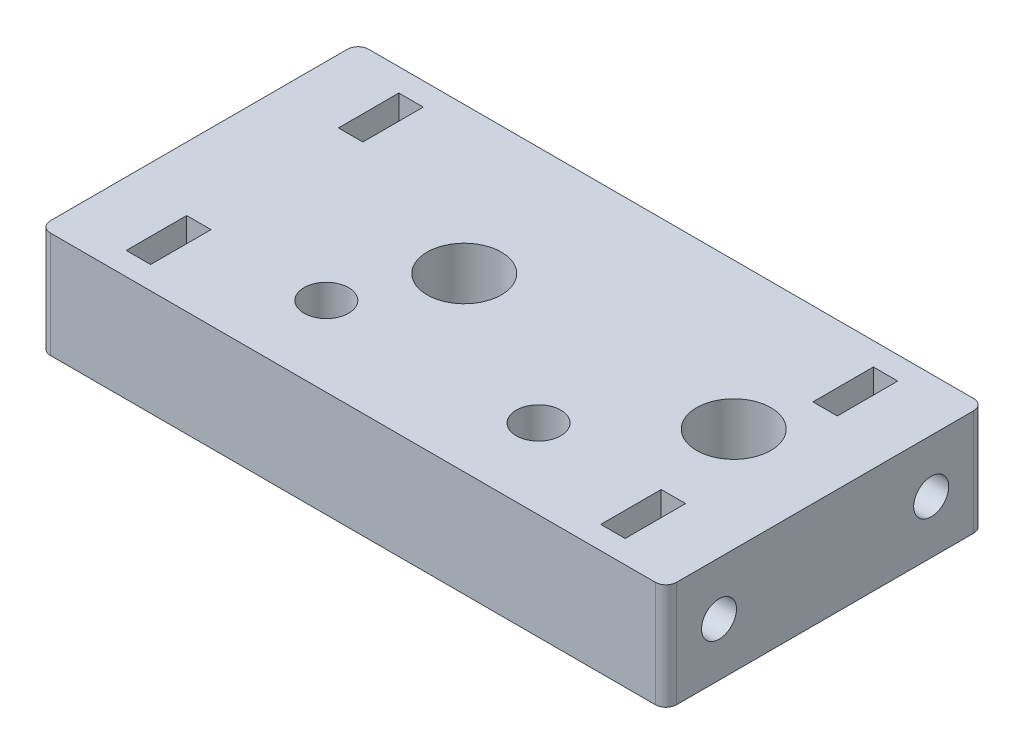
from build123d import *

# Parameters (mm, degrees)
SKETCH1_W           = 59.0272
SKETCH1_H           = 30
BOSS_EXTRUDE1_DEPTH = 10
SKETCH2_R           = 2.1
CUT_EXTRUDE1_DEPTH  = 35.58399319
SKETCH3_R           = 1.65
CUT_EXTRUDE2_DEPTH  = 12
CUT_EXTRUDE3_START  = -12
SKETCH4_R           = 1.65
CUT_EXTRUDE3_DEPTH  = 12
CUT_EXTRUDE4_DEPTH  = 2.3
CUT_EXTRUDE5_DEPTH  = 2.3
SKETCH7_R           = 3.5
CUT_EXTRUDE6_DEPTH  = 35.58399319
FILLET1_R           = 1


with BuildPart() as part:
    # Sketch1 → Boss-Extrude1 (new body)
    with BuildSketch(Plane(origin=(0, 0, 0), x_dir=(1, 0, 0), z_dir=(0, 1, 0))):
        Rectangle(SKETCH1_W, SKETCH1_H)
    extrude(amount=BOSS_EXTRUDE1_DEPTH)

    # Sketch2 → Cut-Extrude1 (cut, through all)
    with BuildSketch(Plane(origin=(0, 10, 0), x_dir=(1, 0, 0), z_dir=(0, 1, 0))):
        with Locations((-10, -7.5)):
            Circle(SKETCH2_R)
        with Locations((10, -7.5)):
            Circle(SKETCH2_R)
    extrude(amount=-CUT_EXTRUDE1_DEPTH, mode=Mode.SUBTRACT)

    # Sketch3 → Cut-Extrude2 (cut)
    with BuildSketch(Plane(origin=(29.5136, 0, 0), x_dir=(0, 0, -1), z_dir=(1, 0, 0))):
        with Locations((-10, 5)):
            Circle(SKETCH3_R)
        with Locations((10, 5)):
            Circle(SKETCH3_R)
    extrude(amount=-CUT_EXTRUDE2_DEPTH, mode=Mode.SUBTRACT)

    # Sketch4 → Cut-Extrude3 (cut)
    with BuildSketch(Plane.ZY.offset(29.5136).offset(CUT_EXTRUDE3_START)):
        with Locations((-10, 5)):
            Circle(SKETCH4_R)
        with Locations((10, 5)):
            Circle(SKETCH4_R)
    extrude(amount=CUT_EXTRUDE3_DEPTH, mode=Mode.SUBTRACT)

    # Sketch5 → Cut-Extrude4 (cut)
    with BuildSketch(Plane(origin=(23.5136, 0, 0), x_dir=(0, 0, -1), z_dir=(1, 0, 0))):
        Polygon((-12.85, 6.645448267), (-12.85, 10), (-7.15, 10), (-7.15, 6.645448267), (-7.15, 3.354551733), (-10, 1.709103466), (-12.85, 3.354551733), align=None)
        Polygon((7.15, 6.645448267), (7.15, 3.354551733), (10, 1.709103466), (12.85, 3.354551733), (12.85, 6.645448267), (12.85, 10), (7.15, 10), align=None)
    extrude(amount=-CUT_EXTRUDE4_DEPTH, mode=Mode.SUBTRACT)

    # Sketch6 → Cut-Extrude5 (cut)
    with BuildSketch(Plane.ZY.offset(23.5136)):
        Polygon((-12.85, 6.645448267), (-12.85, 10), (-7.15, 10), (-7.15, 6.645448267), (-7.15, 3.354551733), (-10, 1.709103466), (-12.85, 3.354551733), align=None)
        Polygon((7.15, 6.645448267), (7.15, 3.354551733), (10, 1.709103466), (12.85, 3.354551733), (12.85, 6.645448267), (12.85, 10), (7.15, 10), align=None)
    extrude(amount=-CUT_EXTRUDE5_DEPTH, mode=Mode.SUBTRACT)

    # Sketch7 → Cut-Extrude6 (cut, through all)
    with BuildSketch(Plane(origin=(0, 10, 0), x_dir=(1, 0, 0), z_dir=(0, 1, 0))):
        with Locations((19.7, 1.2)):
            Circle(SKETCH7_R)
        with Locations((-5.7, 1.2)):
            Circle(SKETCH7_R)
    extrude(amount=-CUT_EXTRUDE6_DEPTH, mode=Mode.SUBTRACT)

    # Fillet1
    fillet1_edges = [part.edges().sort_by_distance(p)[0] for p in [
        (-29.5136, 5, 15),
        (-29.5136, 5, -15),
        (29.5136, 5, -15),
        (29.5136, 5, 15),
    ]]
    fillet(fillet1_edges, radius=FILLET1_R)


solid = part.part
